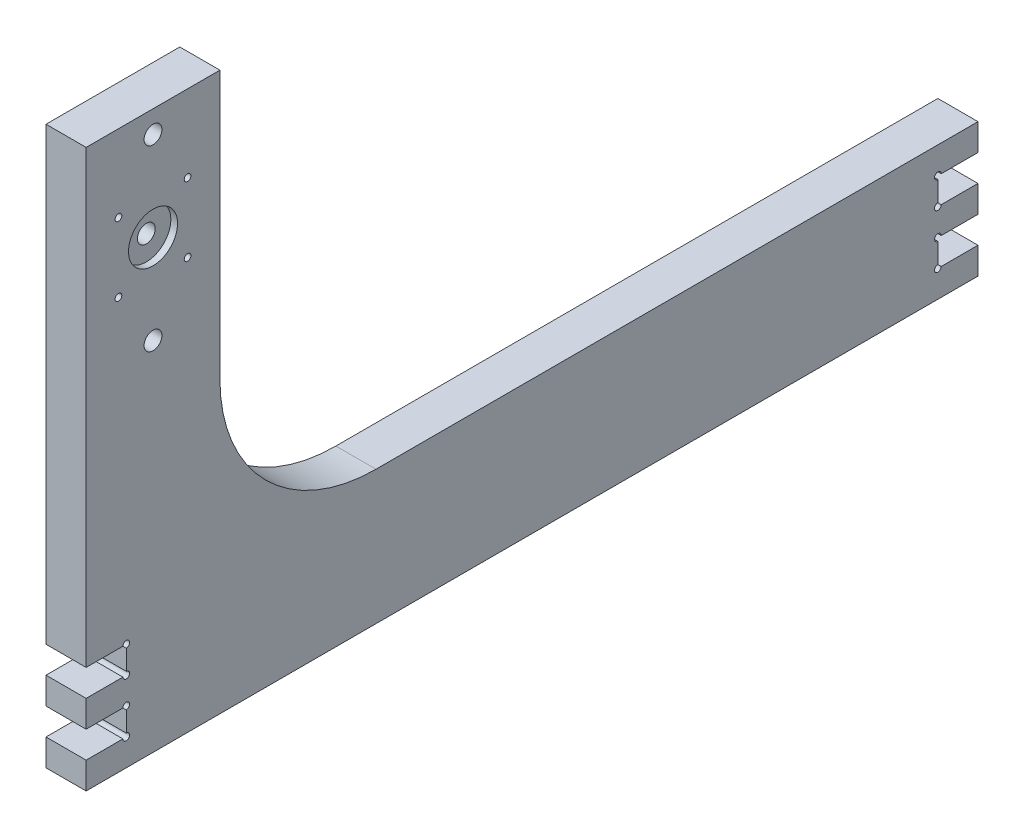
from build123d import *

# Parameters (mm, degrees)
SKETCH1_R           = 4
SKETCH1_R_2         = 1.5
BOSS_EXTRUDE1_DEPTH = 18
SKETCH3_R           = 11
CUT_EXTRUDE1_DEPTH  = 3


with BuildPart() as part:
    # Sketch1 → Boss-Extrude1 (new body)
    with BuildSketch(Plane(origin=(0, 0, 0), x_dir=(0, 0, -1), z_dir=(1, 0, 0))):
        with BuildLine():
            Line((-30, -238), (-30, -250))
            Line((-30, -250), (370, -250))
            Line((370, -250), (370, -238))
            Line((370, -238), (353.5, -238))
            ThreePointArc((353.5, -238), (350.939339828, -239.060660172), (352, -236.5))
            Line((352, -236.5), (352, -227.5))
            ThreePointArc((352, -227.5), (350.939339828, -224.939339828), (353.5, -226))
            Line((353.5, -226), (370, -226))
            Line((370, -226), (370, -214))
            Line((370, -214), (353.5, -214))
            ThreePointArc((353.5, -214), (350.939339828, -215.060660172), (352, -212.5))
            Line((352, -212.5), (352, -203.5))
            ThreePointArc((352, -203.5), (350.939339828, -200.939339828), (353.5, -202))
            Line((353.5, -202), (370, -202))
            Line((370, -202), (370, -190))
            Line((370, -190), (100, -190))
            ThreePointArc((100, -190), (50.502525317, -169.497474683), (30, -120))
            Line((30, -120), (30, 0))
            Line((30, 0), (-30, 0))
            Line((-30, 0), (-30, -202))
            Line((-30, -202), (-13.5, -202))
            ThreePointArc((-13.5, -202), (-10.939339828, -200.939339828), (-12, -203.5))
            Line((-12, -203.5), (-12, -212.5))
            ThreePointArc((-12, -212.5), (-10.939339828, -215.060660172), (-13.5, -214))
            Line((-13.5, -214), (-30, -214))
            Line((-30, -214), (-30, -226))
            Line((-30, -226), (-13.5, -226))
            ThreePointArc((-13.5, -226), (-10.939339828, -224.939339828), (-12, -227.5))
            Line((-12, -227.5), (-12, -236.5))
            ThreePointArc((-12, -236.5), (-10.939339828, -239.060660172), (-13.5, -238))
            Line((-13.5, -238), (-30, -238))
        make_face()
        with Locations((0, -90)):
            Circle(SKETCH1_R, mode=Mode.SUBTRACT)
        with Locations((-15.5, -65.5)):
            Circle(SKETCH1_R_2, mode=Mode.SUBTRACT)
        with Locations((15.5, -65.5)):
            Circle(SKETCH1_R_2, mode=Mode.SUBTRACT)
        with Locations((0, -50)):
            Circle(SKETCH1_R, mode=Mode.SUBTRACT)
        with Locations((-15.5, -34.5)):
            Circle(SKETCH1_R_2, mode=Mode.SUBTRACT)
        with Locations((15.5, -34.5)):
            Circle(SKETCH1_R_2, mode=Mode.SUBTRACT)
        with Locations((0, -10)):
            Circle(SKETCH1_R, mode=Mode.SUBTRACT)
    extrude(amount=BOSS_EXTRUDE1_DEPTH)

    # Sketch3 → Cut-Extrude1 (cut)
    with BuildSketch(Plane(origin=(18, 0, 0), x_dir=(0, 0, -1), z_dir=(1, 0, 0))):
        with Locations((0, -50)):
            Circle(SKETCH3_R)
    extrude(amount=-CUT_EXTRUDE1_DEPTH, mode=Mode.SUBTRACT)


solid = part.part
